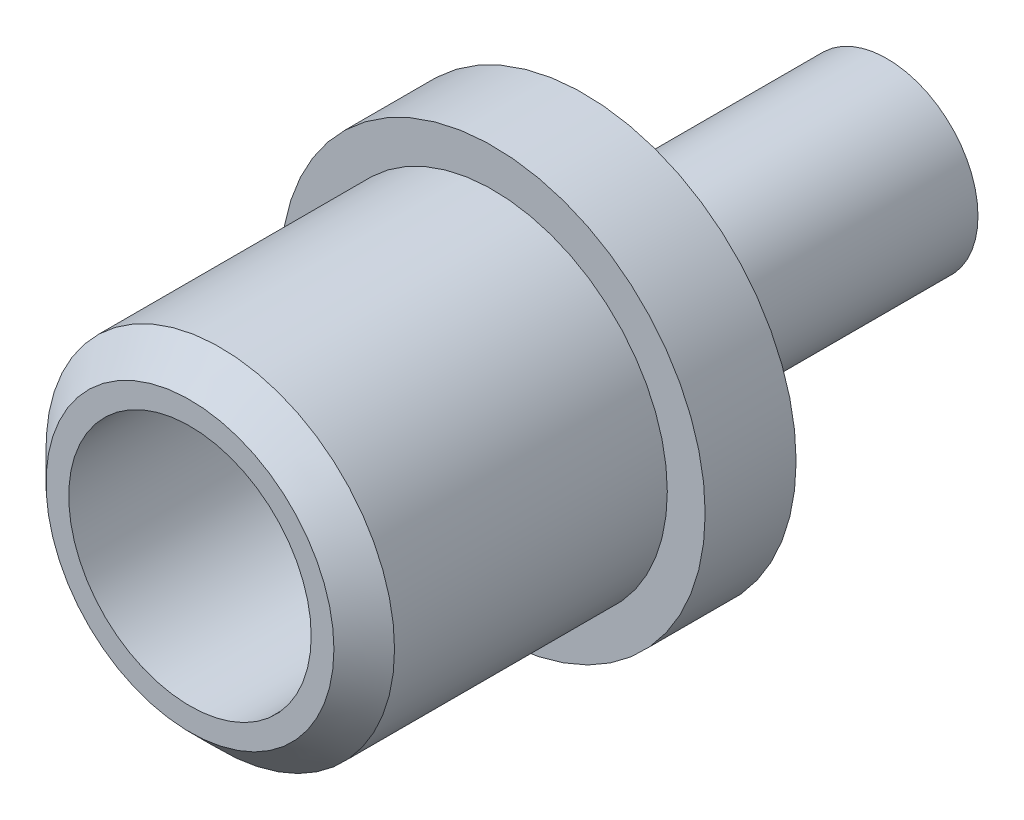
from build123d import *

# Parameters (mm, degrees)
SKETCH1_R           = 5.75
SKETCH1_R_2         = 4
BOSS_EXTRUDE1_DEPTH = 10
BOSS_EXTRUDE2_START = -3
SKETCH1_3_R         = 5.75
SKETCH1_3_R_2       = 3
SKETCH1_3_R_3       = 4
BOSS_EXTRUDE2_DEPTH = 3
BOSS_EXTRUDE3_START = -13
SKETCH1_4_R         = 3
SKETCH1_4_R_2       = 2
BOSS_EXTRUDE3_DEPTH = 13
BOSS_EXTRUDE4_START = -3
SKETCH1_5_R         = 7
SKETCH1_5_R_2       = 5.75
BOSS_EXTRUDE4_DEPTH = 3
FILLET1_R           = 10
CHAMFER1_SIZE       = 1


with BuildPart() as part:
    # Sketch1 → Boss-Extrude1 (new body)
    with BuildSketch(Plane.XY):
        Circle(SKETCH1_R)
        Circle(SKETCH1_R_2, mode=Mode.SUBTRACT)
    extrude(amount=BOSS_EXTRUDE1_DEPTH)

    # Sketch1<3> → Boss-Extrude2 (add)
    # profile 1 of 2: a face of its own
    with BuildSketch(Plane.XY.offset(BOSS_EXTRUDE2_START)):
        Circle(SKETCH1_3_R)
        Circle(SKETCH1_3_R_2, mode=Mode.SUBTRACT)
    # profile 2 of 2: a face of its own
    with BuildSketch(Plane.XY.offset(BOSS_EXTRUDE2_START)):
        Circle(SKETCH1_3_R_3)
        Circle(SKETCH1_3_R_2, mode=Mode.SUBTRACT)
    extrude(amount=BOSS_EXTRUDE2_DEPTH)

    # Sketch1<4> → Boss-Extrude3 (add)
    with BuildSketch(Plane.XY.offset(BOSS_EXTRUDE3_START)):
        Circle(SKETCH1_4_R)
        Circle(SKETCH1_4_R_2, mode=Mode.SUBTRACT)
    extrude(amount=BOSS_EXTRUDE3_DEPTH)

    # Sketch1<5> → Boss-Extrude4 (add)
    with BuildSketch(Plane.XY.offset(BOSS_EXTRUDE4_START)):
        Circle(SKETCH1_5_R)
        Circle(SKETCH1_5_R_2, mode=Mode.SUBTRACT)
    extrude(amount=BOSS_EXTRUDE4_DEPTH)

    # Fillet1
    # the kernel refuses this fillet: 10 mm, written as the material it takes off along each edge
    with BuildSketch(Plane(origin=(0, 0, 0), x_dir=(1, 0, 0), z_dir=(0, -1, 0))) as fillet1_piece_1:
        with BuildLine():
            CenterArc((12, -6), FILLET1_R, 143.130102354, 36.869897646)
            Line((2, -6), (1.8, -6))
            Line((1.8, -6), (1.8, 0))
            Line((1.8, 0), (2, 0.2))
            ThreePointArc((2, 0.2), (3, 0.2), (3.84, 0.12))
            Line((3.84, 0.12), (4, 0))
        make_face()
    revolve(axis=Axis((0, 0, 0), (0, 0, 1)), mode=Mode.SUBTRACT)

    # Chamfer1
    chamfer1_edges = [part.edges().sort_by_distance(p)[0] for p in [
        (-5.75, 0, 10),
    ]]
    chamfer(chamfer1_edges, length=CHAMFER1_SIZE)


solid = part.part
